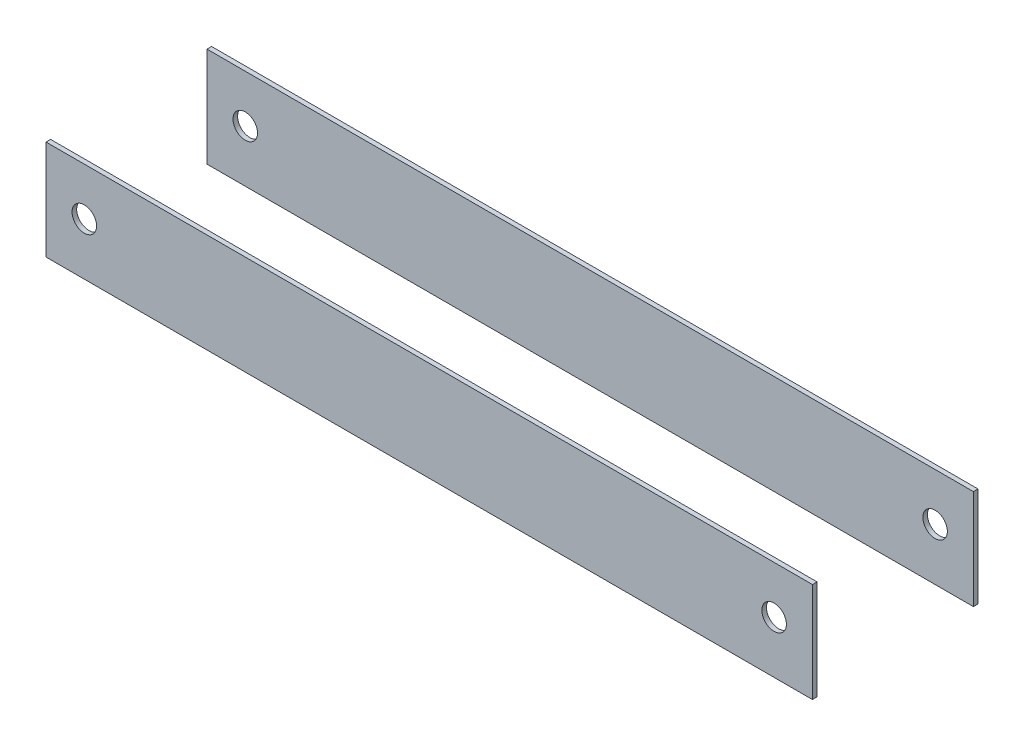
from build123d import *

# Parameters (mm, degrees)
SKETCH1_W           = 500
SKETCH1_H           = 108
BOSS_EXTRUDE1_DEPTH = 65
SKETCH3_W           = 500
SKETCH3_H           = 102
CUT_EXTRUDE1_DEPTH  = 158
SKETCH4_R           = 8
CUT_EXTRUDE2_DEPTH  = 158


with BuildPart() as part:
    # Sketch1 → Boss-Extrude1 (new body)
    with BuildSketch(Plane(origin=(0, 0, 0), x_dir=(1, 0, 0), z_dir=(0, 1, 0))):
        with Locations((16.180492252, 90.484958979)):
            Rectangle(SKETCH1_W, SKETCH1_H)
    extrude(amount=BOSS_EXTRUDE1_DEPTH)

    # Sketch3 → Cut-Extrude1 (cut)
    with BuildSketch(Plane.XZ):
        with Locations((16.180492252, -90.484958979)):
            Rectangle(SKETCH3_W, SKETCH3_H)
    extrude(amount=-CUT_EXTRUDE1_DEPTH, mode=Mode.SUBTRACT)


with BuildPart() as cut_extrude1_piece_1:
    # of the separate pieces the step leaves, piece 1, a body of its own (cut_extrude1_pieces)
    add(part.part.solids().sort_by_distance((-233.819507748, 0, -144.484958979))[0])


with BuildPart() as cut_extrude1_piece_2:
    # of the separate pieces the step leaves, piece 2, a body of its own (cut_extrude1_pieces)
    add(part.part.solids().sort_by_distance((-233.819507748, 0, -36.484958979))[0])


with BuildPart() as cut_extrude2_tool:
    # Sketch4 → Cut-Extrude2 (new body)
    with BuildSketch(Plane.XY.offset(-36.484958979)):
        with Locations((-208.819507748, 34)):
            Circle(SKETCH4_R)
        with Locations((241.180492252, 34)):
            Circle(SKETCH4_R)
    extrude(amount=-CUT_EXTRUDE2_DEPTH)


with BuildPart() as cut_extrude1_piece_1_1:
    add(cut_extrude1_piece_1.part)

    # Cut-Extrude2: cut by cut_extrude2_tool
    add(cut_extrude2_tool.part, mode=Mode.SUBTRACT)


with BuildPart() as cut_extrude1_piece_2_1:
    add(cut_extrude1_piece_2.part)

    # Cut-Extrude2: cut by cut_extrude2_tool
    add(cut_extrude2_tool.part, mode=Mode.SUBTRACT)


solid = Compound([cut_extrude1_piece_1_1.part, cut_extrude1_piece_2_1.part])
